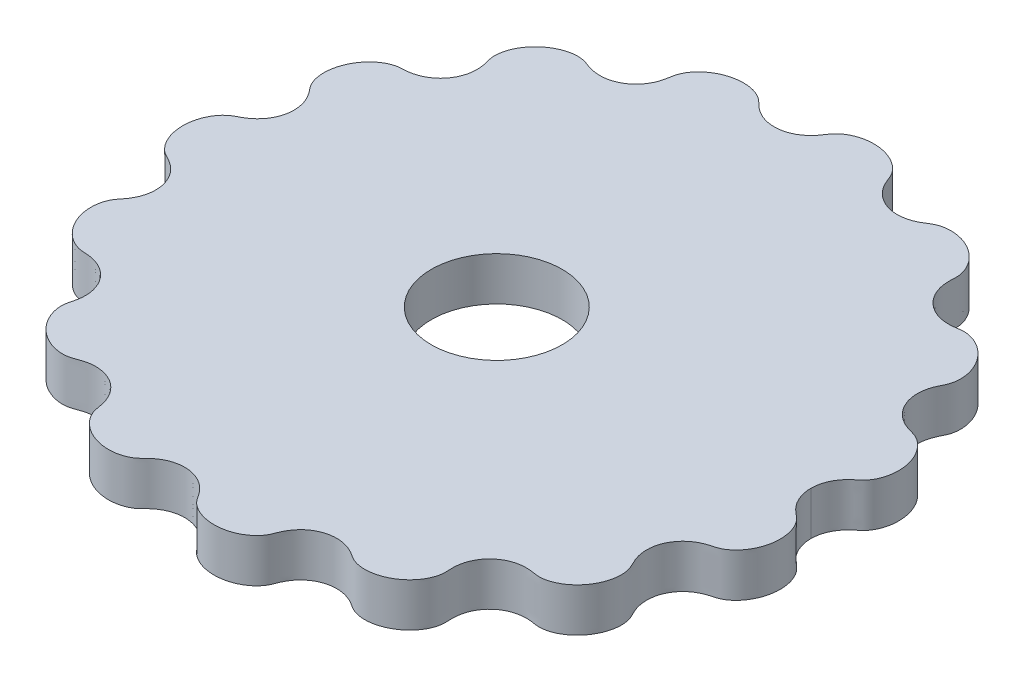
from build123d import *

# Parameters (mm, degrees)
SKETCH7_R     = 9.525
CYCLOID_DEPTH = 6.35


with BuildPart() as part:
    # Sketch7 → cycloid (new body)
    with BuildSketch(Plane(origin=(0, 0, 0), x_dir=(1, 0, 0), z_dir=(0, 1, 0))):
        with BuildLine():
            add(Edge.make_bspline(
                [(45.719999155, 0), (45.719999155, -0.027852913), (45.720523207, -0.084142426), (45.723667533, -0.219142007), (45.734668337, -0.422737194), (45.756648607, -0.638680152), (45.802696684, -0.95439235), (45.867767328, -1.25688153), (45.950899205, -1.555487116), (46.051312788, -1.843945332), (46.142625328, -2.072622532), (46.244760511, -2.297103518), (46.357551054, -2.517680144), (46.492148963, -2.753292359), (46.651489306, -3.00187072), (46.888920905, -3.329517435), (47.174789214, -3.663829161), (47.494359584, -3.98126732), (47.842639799, -4.283514511), (48.143840498, -4.524721572), (48.459755193, -4.789207964), (48.760379856, -5.10831936), (49.036423287, -5.482773664), (49.28245105, -5.909010274), (49.515476992, -6.425499528), (49.713991503, -7.035798845), (49.864361026, -7.785603541), (49.920915347, -8.671347931), (49.853291183, -9.588481508), (49.651617577, -10.517996995), (49.341217813, -11.366839096), (48.944609492, -12.126235001), (48.452167789, -12.826795695), (47.865713941, -13.452646106), (47.267583757, -13.908856682), (46.695766792, -14.208925734), (46.125773318, -14.39798961), (45.585205341, -14.529432682), (44.966622285, -14.731482109), (44.256483393, -15.060592181), (43.553572901, -15.518884887), (42.899049824, -16.114464439), (42.329185938, -16.853297184), (41.893653364, -17.692657883), (41.620267232, -18.574146539), (41.505050833, -19.479245247), (41.538598016, -20.262209594), (41.652869551, -20.902304485), (41.800624905, -21.418253333), (41.945179436, -21.814040484), (42.103497494, -22.172741746), (42.264584595, -22.497258281), (42.416714715, -22.793626229), (42.543655107, -23.0697747), (42.696985497, -23.493797634), (42.822779553, -24.079725508), (42.864086596, -24.822246083), (42.7680085, -25.703365186), (42.488744662, -26.774911335), (42.010184161, -27.801324154), (41.344959913, -28.748045728), (40.539791225, -29.539797045), (39.834086122, -30.064723296), (39.170371864, -30.431607482), (38.58084819, -30.67135398), (38.039953951, -30.824394043), (37.559431027, -30.907132647), (37.075383261, -30.93591139), (36.596021369, -30.894982296), (36.125264144, -30.811613864), (35.652424478, -30.750673686), (35.150168579, -30.718500905), (34.620169787, -30.7308139), (34.091951343, -30.79420231), (33.570994181, -30.911182351), (32.955867194, -31.112993703), (32.283280345, -31.431912211), (31.571351981, -31.918944278), (30.871122427, -32.62141759), (30.325255748, -33.420478199), (29.960701283, -34.242276747), (29.750972075, -35.048132019), (29.672802643, -35.713529028), (29.661565633, -36.235886442), (29.677345697, -36.673808987), (29.698596953, -37.027336684), (29.703048365, -37.411546491), (29.661309347, -37.823681558), (29.542071753, -38.373849004), (29.309148453, -39.000837556), (28.955833366, -39.655459894), (28.303332423, -40.539514926), (27.493783684, -41.300894664), (26.518567622, -41.935321301), (25.44393845, -42.376896594), (24.588514083, -42.598233227), (23.710012726, -42.704033325), (22.948226992, -42.686028787), (22.26983677, -42.572312932), (21.711806881, -42.391425783), (21.31503302, -42.208733181), (20.965307426, -41.993415846), (20.644220682, -41.781484173), (20.252108388, -41.542964015), (19.779268919, -41.2964087), (19.143889622, -41.041198777), (18.335350713, -40.842151502), (17.417063025, -40.771143516), (16.434033788, -40.880579873), (15.508519305, -41.164819623), (14.657229105, -41.60864251), (13.922776436, -42.175659868), (13.394805248, -42.75100255), (13.027965858, -43.279290027), (12.781839094, -43.712830053), (12.623717106, -44.040739596), (12.4591323, -44.417203685), (12.304665286, -44.845512958), (12.069246654, -45.392211449), (11.651682453, -45.995424107), (11.094032702, -46.559458938), (10.403398725, -47.061116576), (9.451402401, -47.569511715), (8.192496183, -47.978121133), (6.869125902, -48.106588034), (5.554646046, -47.946214085), (4.508359101, -47.621325592), (3.726538355, -47.250086195), (3.055672876, -46.781086633), (2.519596688, -46.223546448), (2.133457685, -45.599142501), (1.738656579, -45.025817051), (1.225926036, -44.438885051), (0.560562348, -43.873028476), (-0.221356473, -43.40570797), (-1.111233435, -43.070432876), (-2.059629187, -42.898827714), (-3.004304179, -42.901239152), (-3.924221011, -43.069843846), (-4.744673709, -43.374169224), (-5.449999837, -43.768748718), (-6.050416817, -44.221278384), (-6.553461378, -44.69672091), (-7.066141767, -45.236868355), (-7.736631406, -45.674903833), (-8.521688058, -45.996954014), (-9.401228583, -46.192470019), (-10.527185059, -46.271164228), (-11.897177553, -46.112332181), (-13.178755789, -45.660991741), (-14.304229858, -44.958089314), (-15.02954046, -44.295512806), (-15.440291078, -43.822155033), (-15.754164898, -43.370122701), (-15.985411698, -42.95573348), (-16.167239047, -42.525749176), (-16.291597721, -42.083464946), (-16.360168997, -41.637826982), (-16.431829745, -41.201022969), (-16.541941899, -40.70212003), (-16.71351292, -40.149307978), (-16.993974159, -39.504295567), (-17.439350142, -38.785172067), (-18.040240288, -38.101162354), (-18.803891827, -37.50116752), (-19.679894389, -37.044851382), (-20.609628392, -36.762356461), (-21.507883238, -36.661154846), (-22.343917074, -36.704416527), (-23.005414402, -36.832078039), (-23.509081144, -36.980895337), (-23.92268772, -37.13038749), (-24.252750199, -37.259882985), (-24.616514398, -37.386016562), (-25.021795957, -37.477490604), (-25.583468373, -37.53825133), (-26.254554429, -37.51403159), (-26.989775278, -37.382914353), (-28.037477421, -37.037715899), (-29.230668515, -36.386721597), (-30.254328993, -35.479760448), (-31.046389805, -34.371891093), (-31.523319051, -33.352576399), (-31.743924422, -32.626591063), (-31.848942506, -31.949748094), (-31.853685838, -31.365511206), (-31.806885589, -30.93284072), (-31.713840606, -30.534168219), (-31.611251693, -30.164538466), (-31.504212175, -29.72045879), (-31.413042159, -29.198210446), (-31.361814925, -28.519217702), (-31.414720933, -27.693184556), (-31.621121735, -26.800002043), (-32.018221804, -25.896938235), (-32.56554315, -25.098540606), (-33.245239367, -24.416812212), (-34.009783226, -23.883396246), (-34.721262228, -23.55093134), (-35.338965267, -23.359351495), (-35.829372256, -23.255415214), (-36.191907369, -23.203701623), (-36.602579788, -23.16170924), (-37.058966803, -23.145664097), (-37.653921357, -23.096559203), (-38.360733022, -22.890733519), (-39.074238597, -22.537363456), (-39.769995396, -22.036423596), (-40.553676674, -21.287496226), (-41.335101665, -20.216833891), (-41.868832847, -18.999109063), (-42.125510051, -17.701500239), (-42.143251953, -16.610882579), (-42.036327194, -15.755241493), (-41.802277449, -14.974508915), (-41.445744431, -14.29104338), (-40.976048583, -13.730214907), (-40.550849548, -13.183158345), (-40.149180997, -12.519435563), (-39.81155383, -11.718697503), (-39.602088283, -10.836901914), (-39.548848438, -9.891565005), (-39.668960329, -8.931845606), (-39.957943172, -8.020364162), (-40.407627619, -7.17559293), (-40.971569963, -6.461669455), (-41.52853947, -5.952484879), (-42.030336021, -5.595041559), (-42.427527823, -5.357771177), (-42.737451518, -5.191569448), (-43.037852638, -5.040062694), (-43.32104308, -4.888153803), (-43.721658125, -4.627343522), (-44.19729263, -4.207443386), (-44.671306983, -3.623681683), (-45.100610329, -2.870586701), (-45.494754841, -1.881005775), (-45.666572552, -1.065912263), (-45.72000066, -0.434689), (-45.719999155, 0)],
                knots=[0.068965657, 0.068965657, 0.068965657, 0.068965657, 0.068965657, 0.069298977, 0.069632296, 0.070298935, 0.070965574, 0.071632213, 0.07289848, 0.073531614, 0.074164747, 0.074806873, 0.075448998, 0.076091123, 0.076733248, 0.077621782, 0.078510316, 0.080287384, 0.081288754, 0.082290124, 0.083291494, 0.084292864, 0.085559049, 0.086825234, 0.088107169, 0.089389103, 0.091429085, 0.093469068, 0.09601866, 0.098568251, 0.100936527, 0.103304802, 0.105367337, 0.107429873, 0.109796375, 0.112167922, 0.113129632, 0.114091342, 0.116014761, 0.11794043, 0.119866098, 0.122189065, 0.124687222, 0.127076007, 0.129494333, 0.131949897, 0.134210801, 0.136496116, 0.137588234, 0.138680353, 0.139772471, 0.14086459, 0.141652361, 0.142440132, 0.143227904, 0.144015675, 0.146323541, 0.148631175, 0.15090328, 0.153175384, 0.157772835, 0.160299867, 0.1628269, 0.164848586, 0.166870273, 0.168143433, 0.169416593, 0.170669242, 0.171921891, 0.173157718, 0.174393546, 0.175629373, 0.176865201, 0.178374673, 0.179884146, 0.181139632, 0.182395118, 0.185082553, 0.187579012, 0.190035217, 0.192628962, 0.195065843, 0.196854569, 0.198643295, 0.19956217, 0.200481045, 0.20139992, 0.202318795, 0.203543555, 0.204768314, 0.20722783, 0.209230535, 0.211233241, 0.216135279, 0.218673692, 0.221212105, 0.223243507, 0.225274909, 0.227826973, 0.229088088, 0.230349203, 0.231347488, 0.232345773, 0.233344059, 0.234342344, 0.236106916, 0.237871488, 0.240430553, 0.242947904, 0.2456084, 0.248072079, 0.2504165, 0.252856102, 0.25518776, 0.256132464, 0.257077167, 0.258021871, 0.258966575, 0.260387381, 0.261808188, 0.264173218, 0.266525123, 0.268577079, 0.270629034, 0.275340575, 0.280160425, 0.282213752, 0.284267079, 0.286675452, 0.289102756, 0.290661088, 0.292219419, 0.294273343, 0.296327267, 0.298713608, 0.301248612, 0.303672519, 0.306140086, 0.308659486, 0.310994128, 0.313326749, 0.31517325, 0.317019751, 0.318766257, 0.320512764, 0.322871546, 0.325248685, 0.327531787, 0.329814889, 0.334545534, 0.339450506, 0.341464356, 0.343478207, 0.344708513, 0.34593882, 0.347165771, 0.348392722, 0.349541365, 0.350690009, 0.351838652, 0.352987296, 0.354836612, 0.356685928, 0.359114366, 0.361729559, 0.364229199, 0.366702957, 0.369305078, 0.371753361, 0.373554948, 0.375356536, 0.376276503, 0.377196471, 0.378116438, 0.379036406, 0.380266376, 0.381496347, 0.383964665, 0.385975287, 0.387985908, 0.39290785, 0.397962316, 0.399985079, 0.402007842, 0.404549553, 0.405805379, 0.407061206, 0.408056517, 0.409051828, 0.410047139, 0.41104245, 0.412793947, 0.414545445, 0.417094793, 0.419597307, 0.422251554, 0.424719953, 0.427078755, 0.42953232, 0.431875334, 0.432825732, 0.433776129, 0.434726526, 0.435676923, 0.437099759, 0.438522595, 0.440896502, 0.44325973, 0.445320447, 0.447381165, 0.452113141, 0.456913106, 0.458958202, 0.461003297, 0.463400661, 0.465820252, 0.467373994, 0.468927737, 0.470970392, 0.473013047, 0.475388822, 0.477913131, 0.480321291, 0.482785387, 0.485369076, 0.487777578, 0.490195057, 0.492176966, 0.49316792, 0.494158875, 0.494992069, 0.495825263, 0.496658457, 0.497491651, 0.49994312, 0.502375788, 0.50441454, 0.506453292, 0.510963009, 0.510963009, 0.510963009, 0.510963009, 0.510963009], degree=4))
            add(Edge.make_bspline(
                [(45.719999155, 0), (45.719999155, 0.027852913), (45.720523207, 0.084142425), (45.723667533, 0.219142006), (45.734668337, 0.422737193), (45.756648607, 0.63868015), (45.802696684, 0.954392349), (45.867767328, 1.256881528), (45.950899205, 1.555487115), (46.051312788, 1.84394533), (46.142625328, 2.072622531), (46.244760511, 2.297103516), (46.357551054, 2.517680143), (46.492148963, 2.753292357), (46.651489306, 3.001870718), (46.888920905, 3.329517433), (47.174789214, 3.66382916), (47.494359584, 3.981267318), (47.842639799, 4.28351451), (48.143840498, 4.52472157), (48.459755193, 4.789207962), (48.760379856, 5.108319358), (49.036423287, 5.482773662), (49.28245105, 5.909010273), (49.515476992, 6.425499526), (49.713991503, 7.035798844), (49.864361026, 7.78560354), (49.920915347, 8.67134793), (49.853291183, 9.588481506), (49.651617577, 10.517996994), (49.341217813, 11.366839094), (48.944609492, 12.126234999), (48.452167789, 12.826795694), (47.865713941, 13.452646104), (47.267583758, 13.90885668), (46.695766792, 14.208925732), (46.125773318, 14.397989608), (45.585205342, 14.529432681), (44.966622285, 14.731482107), (44.256483393, 15.060592179), (43.553572901, 15.518884886), (42.899049825, 16.114464438), (42.329185938, 16.853297183), (41.893653364, 17.692657882), (41.620267232, 18.574146537), (41.505050834, 19.479245246), (41.538598016, 20.262209592), (41.652869551, 20.902304484), (41.800624906, 21.418253332), (41.945179436, 21.814040483), (42.103497494, 22.172741744), (42.264584595, 22.49725828), (42.416714715, 22.793626227), (42.543655107, 23.069774699), (42.696985498, 23.493797632), (42.822779553, 24.079725506), (42.864086596, 24.822246082), (42.768008501, 25.703365185), (42.488744662, 26.774911334), (42.010184162, 27.801324153), (41.344959913, 28.748045727), (40.539791225, 29.539797043), (39.834086122, 30.064723294), (39.170371864, 30.431607481), (38.580848191, 30.671353979), (38.039953952, 30.824394042), (37.559431027, 30.907132646), (37.075383261, 30.935911388), (36.596021369, 30.894982295), (36.125264144, 30.811613863), (35.652424478, 30.750673685), (35.15016858, 30.718500904), (34.620169787, 30.730813898), (34.091951343, 30.794202308), (33.570994181, 30.911182349), (32.955867195, 31.112993702), (32.283280346, 31.43191221), (31.571351981, 31.918944277), (30.871122427, 32.621417589), (30.325255749, 33.420478197), (29.960701283, 34.242276746), (29.750972076, 35.048132018), (29.672802644, 35.713529026), (29.661565634, 36.23588644), (29.677345697, 36.673808986), (29.698596954, 37.027336683), (29.703048365, 37.41154649), (29.661309347, 37.823681557), (29.542071754, 38.373849003), (29.309148453, 39.000837555), (28.955833366, 39.655459893), (28.303332424, 40.539514925), (27.493783685, 41.300894663), (26.518567623, 41.9353213), (25.44393845, 42.376896593), (24.588514083, 42.598233226), (23.710012727, 42.704033324), (22.948226993, 42.686028786), (22.26983677, 42.572312931), (21.711806882, 42.391425781), (21.31503302, 42.20873318), (20.965307427, 41.993415845), (20.644220682, 41.781484172), (20.252108389, 41.542964014), (19.779268919, 41.296408699), (19.143889623, 41.041198776), (18.335350713, 40.842151501), (17.417063026, 40.771143516), (16.434033788, 40.880579872), (15.508519306, 41.164819622), (14.657229105, 41.608642509), (13.922776436, 42.175659867), (13.394805248, 42.751002549), (13.027965858, 43.279290026), (12.781839095, 43.712830052), (12.623717106, 44.040739595), (12.459132301, 44.417203684), (12.304665286, 44.845512957), (12.069246655, 45.392211448), (11.651682453, 45.995424106), (11.094032703, 46.559458937), (10.403398726, 47.061116575), (9.451402402, 47.569511715), (8.192496184, 47.978121132), (6.869125903, 48.106588033), (5.554646047, 47.946214084), (4.508359102, 47.621325591), (3.726538355, 47.250086194), (3.055672877, 46.781086632), (2.519596689, 46.223546447), (2.133457686, 45.5991425), (1.73865658, 45.025817051), (1.225926037, 44.43888505), (0.560562349, 43.873028475), (-0.221356472, 43.405707969), (-1.111233434, 43.070432875), (-2.059629187, 42.898827713), (-3.004304178, 42.901239151), (-3.92422101, 43.069843845), (-4.744673708, 43.374169223), (-5.449999836, 43.768748717), (-6.050416816, 44.221278384), (-6.553461378, 44.696720909), (-7.066141767, 45.236868354), (-7.736631406, 45.674903832), (-8.521688057, 45.996954013), (-9.401228583, 46.192470018), (-10.527185058, 46.271164228), (-11.897177552, 46.11233218), (-13.178755788, 45.66099174), (-14.304229857, 44.958089313), (-15.029540459, 44.295512805), (-15.440291077, 43.822155032), (-15.754164897, 43.3701227), (-15.985411697, 42.95573348), (-16.167239046, 42.525749175), (-16.29159772, 42.083464945), (-16.360168996, 41.637826981), (-16.431829745, 41.201022969), (-16.541941898, 40.70212003), (-16.713512919, 40.149307978), (-16.993974159, 39.504295567), (-17.439350141, 38.785172066), (-18.040240287, 38.101162353), (-18.803891827, 37.50116752), (-19.679894389, 37.044851382), (-20.609628391, 36.762356461), (-21.507883237, 36.661154846), (-22.343917074, 36.704416527), (-23.005414402, 36.832078039), (-23.509081144, 36.980895337), (-23.92268772, 37.13038749), (-24.252750199, 37.259882984), (-24.616514398, 37.386016562), (-25.021795957, 37.477490603), (-25.583468373, 37.538251329), (-26.254554429, 37.514031589), (-26.989775278, 37.382914353), (-28.037477421, 37.037715899), (-29.230668515, 36.386721596), (-30.254328993, 35.479760448), (-31.046389804, 34.371891093), (-31.523319051, 33.352576398), (-31.743924421, 32.626591063), (-31.848942506, 31.949748094), (-31.853685837, 31.365511206), (-31.806885589, 30.93284072), (-31.713840605, 30.534168219), (-31.611251693, 30.164538466), (-31.504212175, 29.72045879), (-31.413042159, 29.198210445), (-31.361814925, 28.519217701), (-31.414720932, 27.693184556), (-31.621121735, 26.800002043), (-32.018221804, 25.896938234), (-32.56554315, 25.098540606), (-33.245239367, 24.416812212), (-34.009783226, 23.883396246), (-34.721262228, 23.55093134), (-35.338965266, 23.359351495), (-35.829372256, 23.255415214), (-36.191907368, 23.203701623), (-36.602579787, 23.161709239), (-37.058966802, 23.145664097), (-37.653921357, 23.096559203), (-38.360733022, 22.890733519), (-39.074238597, 22.537363456), (-39.769995395, 22.036423596), (-40.553676673, 21.287496226), (-41.335101665, 20.216833891), (-41.868832847, 18.999109063), (-42.125510051, 17.701500239), (-42.143251953, 16.610882579), (-42.036327194, 15.755241493), (-41.802277449, 14.974508914), (-41.445744431, 14.29104338), (-40.976048582, 13.730214907), (-40.550849548, 13.183158345), (-40.149180997, 12.519435563), (-39.81155383, 11.718697503), (-39.602088283, 10.836901914), (-39.548848438, 9.891565005), (-39.668960329, 8.931845606), (-39.957943172, 8.020364162), (-40.407627619, 7.175592929), (-40.971569963, 6.461669455), (-41.52853947, 5.952484879), (-42.030336021, 5.595041559), (-42.427527823, 5.357771176), (-42.737451517, 5.191569448), (-43.037852638, 5.040062694), (-43.32104308, 4.888153803), (-43.721658125, 4.627343522), (-44.19729263, 4.207443386), (-44.671306983, 3.623681683), (-45.100610329, 2.870586701), (-45.494754841, 1.881005775), (-45.666572552, 1.065912263), (-45.72000066, 0.434689), (-45.719999155, 0)],
                knots=[0.068965657, 0.068965657, 0.068965657, 0.068965657, 0.068965657, 0.069298977, 0.069632296, 0.070298935, 0.070965574, 0.071632213, 0.07289848, 0.073531614, 0.074164747, 0.074806873, 0.075448998, 0.076091123, 0.076733248, 0.077621782, 0.078510316, 0.080287384, 0.081288754, 0.082290124, 0.083291494, 0.084292864, 0.085559049, 0.086825234, 0.088107169, 0.089389103, 0.091429085, 0.093469068, 0.09601866, 0.098568251, 0.100936527, 0.103304802, 0.105367337, 0.107429873, 0.109796375, 0.112167922, 0.113129632, 0.114091342, 0.116014761, 0.11794043, 0.119866098, 0.122189065, 0.124687222, 0.127076007, 0.129494333, 0.131949897, 0.134210801, 0.136496116, 0.137588234, 0.138680353, 0.139772471, 0.14086459, 0.141652361, 0.142440132, 0.143227904, 0.144015675, 0.146323541, 0.148631175, 0.15090328, 0.153175384, 0.157772835, 0.160299867, 0.1628269, 0.164848586, 0.166870273, 0.168143433, 0.169416593, 0.170669242, 0.171921891, 0.173157718, 0.174393546, 0.175629373, 0.176865201, 0.178374673, 0.179884146, 0.181139632, 0.182395118, 0.185082553, 0.187579012, 0.190035217, 0.192628962, 0.195065843, 0.196854569, 0.198643295, 0.19956217, 0.200481045, 0.20139992, 0.202318795, 0.203543555, 0.204768314, 0.20722783, 0.209230535, 0.211233241, 0.216135279, 0.218673692, 0.221212105, 0.223243507, 0.225274909, 0.227826973, 0.229088088, 0.230349203, 0.231347488, 0.232345773, 0.233344059, 0.234342344, 0.236106916, 0.237871488, 0.240430553, 0.242947904, 0.2456084, 0.248072079, 0.2504165, 0.252856102, 0.25518776, 0.256132464, 0.257077167, 0.258021871, 0.258966575, 0.260387381, 0.261808188, 0.264173218, 0.266525123, 0.268577079, 0.270629034, 0.275340575, 0.280160425, 0.282213752, 0.284267079, 0.286675452, 0.289102756, 0.290661088, 0.292219419, 0.294273343, 0.296327267, 0.298713608, 0.301248612, 0.303672519, 0.306140086, 0.308659486, 0.310994128, 0.313326749, 0.31517325, 0.317019751, 0.318766257, 0.320512764, 0.322871546, 0.325248685, 0.327531787, 0.329814889, 0.334545534, 0.339450506, 0.341464356, 0.343478207, 0.344708513, 0.34593882, 0.347165771, 0.348392722, 0.349541365, 0.350690009, 0.351838652, 0.352987296, 0.354836612, 0.356685928, 0.359114366, 0.361729559, 0.364229199, 0.366702957, 0.369305078, 0.371753361, 0.373554948, 0.375356536, 0.376276503, 0.377196471, 0.378116438, 0.379036406, 0.380266376, 0.381496347, 0.383964665, 0.385975287, 0.387985908, 0.39290785, 0.397962316, 0.399985079, 0.402007842, 0.404549553, 0.405805379, 0.407061206, 0.408056517, 0.409051828, 0.410047139, 0.41104245, 0.412793947, 0.414545445, 0.417094793, 0.419597307, 0.422251554, 0.424719953, 0.427078755, 0.42953232, 0.431875334, 0.432825732, 0.433776129, 0.434726526, 0.435676923, 0.437099759, 0.438522595, 0.440896502, 0.44325973, 0.445320447, 0.447381165, 0.452113141, 0.456913106, 0.458958202, 0.461003297, 0.463400661, 0.465820252, 0.467373994, 0.468927737, 0.470970392, 0.473013047, 0.475388822, 0.477913131, 0.480321291, 0.482785387, 0.485369076, 0.487777578, 0.490195057, 0.492176966, 0.49316792, 0.494158875, 0.494992069, 0.495825263, 0.496658457, 0.497491651, 0.49994312, 0.502375788, 0.50441454, 0.506453292, 0.510963009, 0.510963009, 0.510963009, 0.510963009, 0.510963009], degree=4))
        make_face()
        Circle(SKETCH7_R, mode=Mode.SUBTRACT)
    extrude(amount=CYCLOID_DEPTH)


solid = part.part
